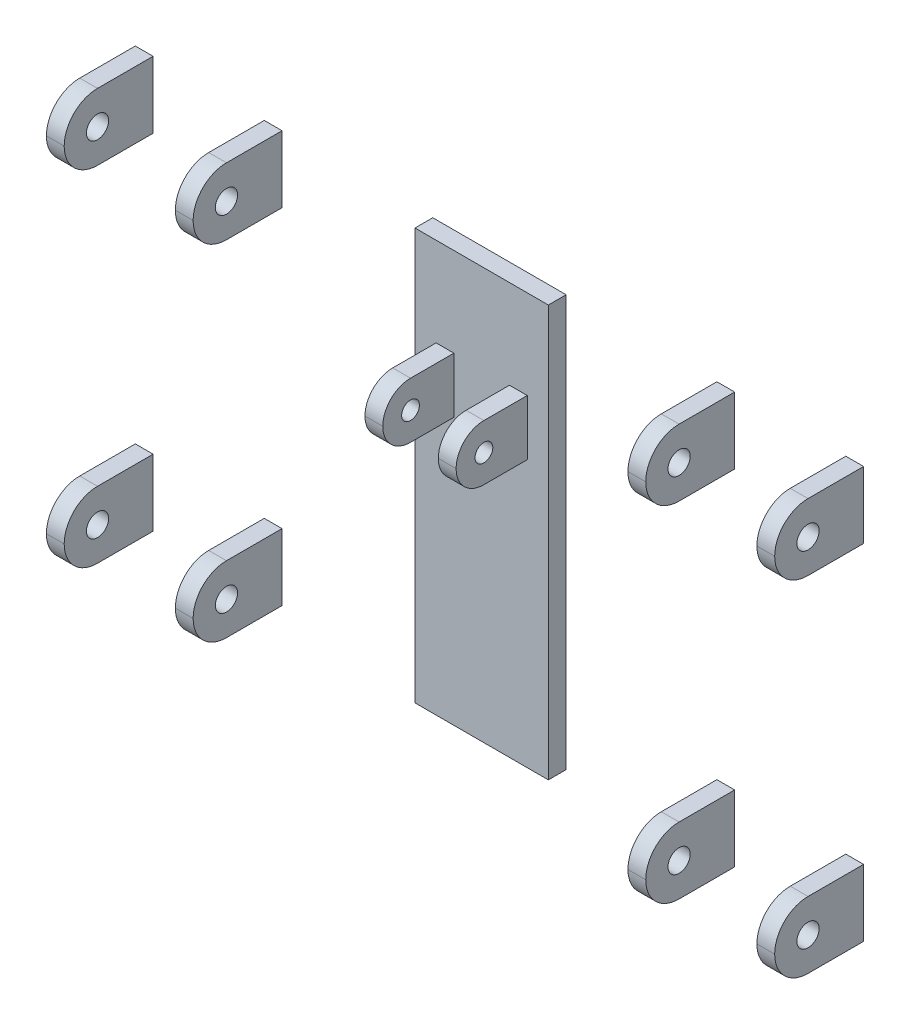
from build123d import *

# Parameters (mm, degrees)
SKETCH1_W             = 8
SKETCH1_H             = 30
BOSS_EXTRUDE1_DEPTH   = 40
BOSS_EXTRUDE1_2_DEPTH = 40
BOSS_EXTRUDE1_3_DEPTH = 40
BOSS_EXTRUDE1_4_DEPTH = 40
BOSS_EXTRUDE1_5_DEPTH = 40
BOSS_EXTRUDE1_6_DEPTH = 40
BOSS_EXTRUDE1_7_DEPTH = 40
BOSS_EXTRUDE1_8_DEPTH = 40
FILLET1_R             = 15
FILLET2_R             = 15
FILLET3_R             = 15
FILLET4_R             = 15
FILLET5_R             = 15
FILLET6_R             = 15
FILLET7_R             = 15
FILLET8_R             = 15
SKETCH4_R             = 5
CUT_EXTRUDE2_DEPTH    = 343.741094851
SKETCH3_R             = 5
CUT_EXTRUDE1_DEPTH    = 343.741094851
SKETCH5_W             = 60
SKETCH5_H             = 185
BOSS_EXTRUDE2_DEPTH   = 8
SKETCH6_W             = 8
SKETCH6_H             = 25
BOSS_EXTRUDE3_DEPTH   = 40
FILLET9_R             = 12.5
SKETCH7_R             = 4
CUT_EXTRUDE3_DEPTH    = 211.049748929


with BuildPart() as part:
    # Sketch1 → Boss-Extrude1 (new body)
    with BuildSketch(Plane.XY):
        with Locations((-159.795, 77.5)):
            Rectangle(SKETCH1_W, SKETCH1_H)
    extrude(amount=BOSS_EXTRUDE1_DEPTH)

    # Fillet1
    fillet1_edges = [part.edges().sort_by_distance(p)[0] for p in [
        (-159.795, 62.5, 40),
        (-159.795, 92.5, 40),
    ]]
    fillet(fillet1_edges, radius=FILLET1_R - 0.0001)  # a hair under: the kernel refuses the full size


with BuildPart() as body_2:
    # Sketch1 → Boss-Extrude1 2 (new body)
    with BuildSketch(Plane.XY):
        with Locations((-101.795, 77.5)):
            Rectangle(SKETCH1_W, SKETCH1_H)
    extrude(amount=BOSS_EXTRUDE1_2_DEPTH)

    # Fillet2
    fillet2_edges = [body_2.edges().sort_by_distance(p)[0] for p in [
        (-101.795, 62.5, 40),
        (-101.795, 92.5, 40),
    ]]
    fillet(fillet2_edges, radius=FILLET2_R - 0.0001)  # a hair under: the kernel refuses the full size


with BuildPart() as body_3:
    # Sketch1 → Boss-Extrude1 3 (new body)
    with BuildSketch(Plane.XY):
        with Locations((101.795, 77.5)):
            Rectangle(SKETCH1_W, SKETCH1_H)
    extrude(amount=BOSS_EXTRUDE1_3_DEPTH)

    # Fillet3
    fillet3_edges = [body_3.edges().sort_by_distance(p)[0] for p in [
        (101.795, 62.5, 40),
        (101.795, 92.5, 40),
    ]]
    fillet(fillet3_edges, radius=FILLET3_R - 0.0001)  # a hair under: the kernel refuses the full size


with BuildPart() as body_4:
    # Sketch1 → Boss-Extrude1 4 (new body)
    with BuildSketch(Plane.XY):
        with Locations((159.795, 77.5)):
            Rectangle(SKETCH1_W, SKETCH1_H)
    extrude(amount=BOSS_EXTRUDE1_4_DEPTH)

    # Fillet4
    fillet4_edges = [body_4.edges().sort_by_distance(p)[0] for p in [
        (159.795, 62.5, 40),
        (159.795, 92.5, 40),
    ]]
    fillet(fillet4_edges, radius=FILLET4_R - 0.0001)  # a hair under: the kernel refuses the full size


with BuildPart() as body_5:
    # Sketch1 → Boss-Extrude1 5 (new body)
    with BuildSketch(Plane.XY):
        with Locations((159.795, -77.5)):
            Rectangle(SKETCH1_W, SKETCH1_H)
    extrude(amount=BOSS_EXTRUDE1_5_DEPTH)

    # Fillet8
    fillet8_edges = [body_5.edges().sort_by_distance(p)[0] for p in [
        (159.795, -92.5, 40),
        (159.795, -62.5, 40),
    ]]
    fillet(fillet8_edges, radius=FILLET8_R - 0.0001)  # a hair under: the kernel refuses the full size


with BuildPart() as body_6:
    # Sketch1 → Boss-Extrude1 6 (new body)
    with BuildSketch(Plane.XY):
        with Locations((101.795, -77.5)):
            Rectangle(SKETCH1_W, SKETCH1_H)
    extrude(amount=BOSS_EXTRUDE1_6_DEPTH)

    # Fillet7
    fillet7_edges = [body_6.edges().sort_by_distance(p)[0] for p in [
        (101.795, -92.5, 40),
        (101.795, -62.5, 40),
    ]]
    fillet(fillet7_edges, radius=FILLET7_R - 0.0001)  # a hair under: the kernel refuses the full size


with BuildPart() as body_7:
    # Sketch1 → Boss-Extrude1 7 (new body)
    with BuildSketch(Plane.XY):
        with Locations((-101.795, -77.5)):
            Rectangle(SKETCH1_W, SKETCH1_H)
    extrude(amount=BOSS_EXTRUDE1_7_DEPTH)

    # Fillet6
    fillet6_edges = [body_7.edges().sort_by_distance(p)[0] for p in [
        (-101.795, -92.5, 40),
        (-101.795, -62.5, 40),
    ]]
    fillet(fillet6_edges, radius=FILLET6_R - 0.0001)  # a hair under: the kernel refuses the full size


with BuildPart() as body_8:
    # Sketch1 → Boss-Extrude1 8 (new body)
    with BuildSketch(Plane.XY):
        with Locations((-159.795, -77.5)):
            Rectangle(SKETCH1_W, SKETCH1_H)
    extrude(amount=BOSS_EXTRUDE1_8_DEPTH)

    # Fillet5
    fillet5_edges = [body_8.edges().sort_by_distance(p)[0] for p in [
        (-159.795, -92.5, 40),
        (-159.795, -62.5, 40),
    ]]
    fillet(fillet5_edges, radius=FILLET5_R - 0.0001)  # a hair under: the kernel refuses the full size


with BuildPart() as cut_extrude2_tool:
    # Sketch4 → Cut-Extrude2 (new, through all)
    with BuildSketch(Plane.ZY.offset(163.795)):
        with Locations((25, -77.5)):
            Circle(SKETCH4_R)
    extrude(amount=-CUT_EXTRUDE2_DEPTH)


with BuildPart() as body_5_1:
    add(body_5.part)

    # Cut-Extrude2: cut by cut_extrude2_tool
    add(cut_extrude2_tool.part, mode=Mode.SUBTRACT)


with BuildPart() as body_6_1:
    add(body_6.part)

    # Cut-Extrude2: cut by cut_extrude2_tool
    add(cut_extrude2_tool.part, mode=Mode.SUBTRACT)


with BuildPart() as body_7_1:
    add(body_7.part)

    # Cut-Extrude2: cut by cut_extrude2_tool
    add(cut_extrude2_tool.part, mode=Mode.SUBTRACT)


with BuildPart() as body_8_1:
    add(body_8.part)

    # Cut-Extrude2: cut by cut_extrude2_tool
    add(cut_extrude2_tool.part, mode=Mode.SUBTRACT)


with BuildPart() as cut_extrude1_tool:
    # Sketch3 → Cut-Extrude1 (new, through all)
    with BuildSketch(Plane.ZY.offset(163.795)):
        with Locations((25, 77.5)):
            Circle(SKETCH3_R)
    extrude(amount=-CUT_EXTRUDE1_DEPTH)


with BuildPart() as part_1:
    add(part.part)

    # Cut-Extrude1: cut by cut_extrude1_tool
    add(cut_extrude1_tool.part, mode=Mode.SUBTRACT)


with BuildPart() as body_2_1:
    add(body_2.part)

    # Cut-Extrude1: cut by cut_extrude1_tool
    add(cut_extrude1_tool.part, mode=Mode.SUBTRACT)


with BuildPart() as body_3_1:
    add(body_3.part)

    # Cut-Extrude1: cut by cut_extrude1_tool
    add(cut_extrude1_tool.part, mode=Mode.SUBTRACT)


with BuildPart() as body_4_1:
    add(body_4.part)

    # Cut-Extrude1: cut by cut_extrude1_tool
    add(cut_extrude1_tool.part, mode=Mode.SUBTRACT)


with BuildPart() as body_9:
    # Sketch5 → Boss-Extrude2 (new body)
    with BuildSketch(Plane(origin=(0, 0, 0), x_dir=(-1, 0, 0), z_dir=(0, 0, -1))):
        Rectangle(SKETCH5_W, SKETCH5_H)
    extrude(amount=-BOSS_EXTRUDE2_DEPTH)

    # Sketch6 → Boss-Extrude3 (add)
    with BuildSketch(Plane(origin=(0, 0, 0), x_dir=(-1, 0, 0), z_dir=(0, 0, -1))):
        with Locations((16.5, 40)):
            Rectangle(SKETCH6_W, SKETCH6_H)
        with Locations((-16.5, 40)):
            Rectangle(SKETCH6_W, SKETCH6_H)
    extrude(amount=-BOSS_EXTRUDE3_DEPTH)

    # Fillet9
    fillet9_edges = [body_9.edges().sort_by_distance(p)[0] for p in [
        (16.5, 52.5, 40),
        (16.5, 27.5, 40),
        (-16.5, 52.5, 40),
        (-16.5, 27.5, 40),
    ]]
    fillet(fillet9_edges, radius=FILLET9_R - 0.0001)  # a hair under: the kernel refuses the full size

    # Sketch7 → Cut-Extrude3 (cut, through all)
    with BuildSketch(Plane.ZY.offset(20.5)):
        with Locations(Location((27.5, 40, 0), (0, 0, 90))):
            Circle(SKETCH7_R)
    extrude(amount=-CUT_EXTRUDE3_DEPTH, mode=Mode.SUBTRACT)


solid = Compound([body_5_1.part, body_6_1.part, body_7_1.part, body_8_1.part, part_1.part, body_2_1.part, body_3_1.part, body_4_1.part, body_9.part])
